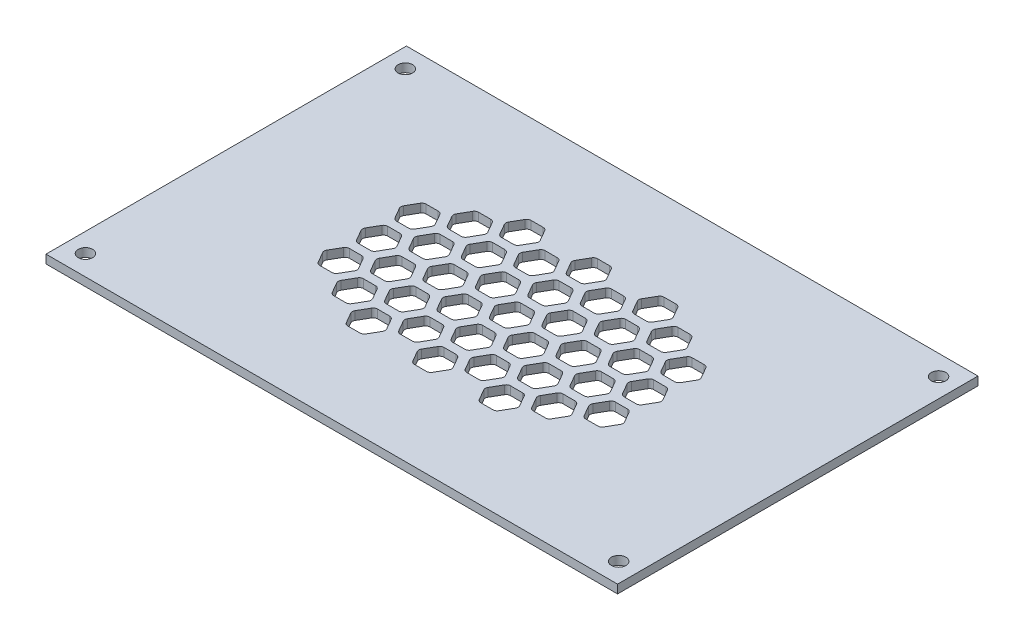
from build123d import *

# Parameters (mm, degrees)
SKETCH1_W                = 134
SKETCH1_H                = 84.5
BOSS_EXTRUDE1_DEPTH      = 2
M3_CLEARANCE_HOLE1_D     = 3.4
M3_CLEARANCE_HOLE1_DEPTH = 5
M3_CLEARANCE_HOLE1_TIP   = 1.021463052
FILL_PATTERN1_DEPTH      = 2
FILLET1_R                = 1


# Read off the part's stored shape, not the designer's step: Fill Pattern1
with BuildPart() as part:
    # Sketch1 → Boss-Extrude1 (new body)
    with BuildSketch(Plane(origin=(0, 0, 0), x_dir=(1, 0, 0), z_dir=(0, 1, 0))):
        with Locations((67, 42.25)):
            Rectangle(SKETCH1_W, SKETCH1_H)
    extrude(amount=BOSS_EXTRUDE1_DEPTH)

    # M3 Clearance Hole1
    with Locations(Plane(origin=(0, 2, 0), x_dir=(1, 0, 0), z_dir=(0, 1, 0))):
        with Locations((4.5, 79.75), (129.5, 79.75), (129.5, 4.75), (4.5, 4.75)):
            Hole(M3_CLEARANCE_HOLE1_D / 2, depth=M3_CLEARANCE_HOLE1_DEPTH)
            with Locations((0, 0, -(M3_CLEARANCE_HOLE1_DEPTH + M3_CLEARANCE_HOLE1_TIP / 2))):  # 118° drill point
                Cone(0, M3_CLEARANCE_HOLE1_D / 2, M3_CLEARANCE_HOLE1_TIP, mode=Mode.SUBTRACT)

    # Fill Pattern1 outline → Fill Pattern1 (cut)
    with BuildSketch(Plane(origin=(0, 0, 0), x_dir=(1, 0, 0), z_dir=(0, 1, 0))):
        Polygon((86.588457268, 24.25), (84.588457268, 27.714101615), (80.588457268, 27.714101615), (78.588457268, 24.25), (80.588457268, 20.785898385), (84.588457268, 20.785898385), align=None)
        Polygon((78.794228634, 37.75), (76.794228634, 41.214101615), (72.794228634, 41.214101615), (70.794228634, 37.75), (72.794228634, 34.285898385), (76.794228634, 34.285898385), align=None)
        Polygon((71, 51.25), (69, 54.714101615), (65, 54.714101615), (63, 51.25), (65, 47.785898385), (69, 47.785898385), align=None)
        Polygon((69, 27.714101615), (65, 27.714101615), (63, 24.25), (65, 20.785898385), (69, 20.785898385), (71, 24.25), align=None)
        Polygon((53.411542732, 27.714101615), (49.411542732, 27.714101615), (47.411542732, 24.25), (49.411542732, 20.785898385), (53.411542732, 20.785898385), (55.411542732, 24.25), align=None)
        Polygon((88.382685902, 41.214101615), (86.382685902, 37.75), (88.382685902, 34.285898385), (92.382685902, 34.285898385), (94.382685902, 37.75), (92.382685902, 41.214101615), align=None)
        Polygon((96.176914536, 54.714101615), (94.176914536, 51.25), (96.176914536, 47.785898385), (100.176914536, 47.785898385), (102.176914536, 51.25), (100.176914536, 54.714101615), align=None)
        Polygon((39.823085464, 33.25), (37.823085464, 36.714101615), (33.823085464, 36.714101615), (31.823085464, 33.25), (33.823085464, 29.785898385), (37.823085464, 29.785898385), align=None)
        Polygon((100.176914536, 36.714101615), (96.176914536, 36.714101615), (94.176914536, 33.25), (96.176914536, 29.785898385), (100.176914536, 29.785898385), (102.176914536, 33.25), align=None)
        Polygon((53.411542732, 36.714101615), (49.411542732, 36.714101615), (47.411542732, 33.25), (49.411542732, 29.785898385), (53.411542732, 29.785898385), (55.411542732, 33.25), align=None)
        Polygon((84.588457268, 36.714101615), (80.588457268, 36.714101615), (78.588457268, 33.25), (80.588457268, 29.785898385), (84.588457268, 29.785898385), (86.588457268, 33.25), align=None)
        Polygon((69, 36.714101615), (65, 36.714101615), (63, 33.25), (65, 29.785898385), (69, 29.785898385), (71, 33.25), align=None)
        Polygon((41.617314098, 50.214101615), (39.617314098, 46.75), (41.617314098, 43.285898385), (45.617314098, 43.285898385), (47.617314098, 46.75), (45.617314098, 50.214101615), align=None)
        Polygon((49.411542732, 63.714101615), (47.411542732, 60.25), (49.411542732, 56.785898385), (53.411542732, 56.785898385), (55.411542732, 60.25), (53.411542732, 63.714101615), align=None)
        Polygon((39.823085464, 42.25), (37.823085464, 45.714101615), (33.823085464, 45.714101615), (31.823085464, 42.25), (33.823085464, 38.785898385), (37.823085464, 38.785898385), align=None)
        Polygon((47.617314098, 28.75), (45.617314098, 32.214101615), (41.617314098, 32.214101615), (39.617314098, 28.75), (41.617314098, 25.285898385), (45.617314098, 25.285898385), align=None)
        Polygon((53.411542732, 45.714101615), (49.411542732, 45.714101615), (47.411542732, 42.25), (49.411542732, 38.785898385), (53.411542732, 38.785898385), (55.411542732, 42.25), align=None)
        Polygon((69, 45.714101615), (65, 45.714101615), (63, 42.25), (65, 38.785898385), (69, 38.785898385), (71, 42.25), align=None)
        Polygon((100.176914536, 45.714101615), (96.176914536, 45.714101615), (94.176914536, 42.25), (96.176914536, 38.785898385), (100.176914536, 38.785898385), (102.176914536, 42.25), align=None)
        Polygon((84.588457268, 45.714101615), (80.588457268, 45.714101615), (78.588457268, 42.25), (80.588457268, 38.785898385), (84.588457268, 38.785898385), (86.588457268, 42.25), align=None)
        Polygon((41.617314098, 59.214101615), (39.617314098, 55.75), (41.617314098, 52.285898385), (45.617314098, 52.285898385), (47.617314098, 55.75), (45.617314098, 59.214101615), align=None)
        Polygon((39.823085464, 51.25), (37.823085464, 54.714101615), (33.823085464, 54.714101615), (31.823085464, 51.25), (33.823085464, 47.785898385), (37.823085464, 47.785898385), align=None)
        Polygon((47.617314098, 37.75), (45.617314098, 41.214101615), (41.617314098, 41.214101615), (39.617314098, 37.75), (41.617314098, 34.285898385), (45.617314098, 34.285898385), align=None)
        Polygon((53.411542732, 54.714101615), (49.411542732, 54.714101615), (47.411542732, 51.25), (49.411542732, 47.785898385), (53.411542732, 47.785898385), (55.411542732, 51.25), align=None)
        Polygon((84.588457268, 54.714101615), (80.588457268, 54.714101615), (78.588457268, 51.25), (80.588457268, 47.785898385), (84.588457268, 47.785898385), (86.588457268, 51.25), align=None)
        Polygon((94.382685902, 28.75), (92.382685902, 32.214101615), (88.382685902, 32.214101615), (86.382685902, 28.75), (88.382685902, 25.285898385), (92.382685902, 25.285898385), align=None)
        Polygon((78.794228634, 55.75), (76.794228634, 59.214101615), (72.794228634, 59.214101615), (70.794228634, 55.75), (72.794228634, 52.285898385), (76.794228634, 52.285898385), align=None)
        Polygon((76.794228634, 32.214101615), (72.794228634, 32.214101615), (70.794228634, 28.75), (72.794228634, 25.285898385), (76.794228634, 25.285898385), (78.794228634, 28.75), align=None)
        Polygon((61.205771366, 32.214101615), (57.205771366, 32.214101615), (55.205771366, 28.75), (57.205771366, 25.285898385), (61.205771366, 25.285898385), (63.205771366, 28.75), align=None)
        Polygon((63.205771366, 37.75), (61.205771366, 41.214101615), (57.205771366, 41.214101615), (55.205771366, 37.75), (57.205771366, 34.285898385), (61.205771366, 34.285898385), align=None)
        Polygon((57.205771366, 59.214101615), (55.205771366, 55.75), (57.205771366, 52.285898385), (61.205771366, 52.285898385), (63.205771366, 55.75), (61.205771366, 59.214101615), align=None)
        Polygon((61.205771366, 50.214101615), (57.205771366, 50.214101615), (55.205771366, 46.75), (57.205771366, 43.285898385), (61.205771366, 43.285898385), (63.205771366, 46.75), align=None)
        Polygon((76.794228634, 50.214101615), (72.794228634, 50.214101615), (70.794228634, 46.75), (72.794228634, 43.285898385), (76.794228634, 43.285898385), (78.794228634, 46.75), align=None)
        Polygon((92.382685902, 50.214101615), (88.382685902, 50.214101615), (86.382685902, 46.75), (88.382685902, 43.285898385), (92.382685902, 43.285898385), (94.382685902, 46.75), align=None)
        Polygon((92.382685902, 59.214101615), (88.382685902, 59.214101615), (86.382685902, 55.75), (88.382685902, 52.285898385), (92.382685902, 52.285898385), (94.382685902, 55.75), align=None)
        Polygon((86.588457268, 60.25), (84.588457268, 63.714101615), (80.588457268, 63.714101615), (78.588457268, 60.25), (80.588457268, 56.785898385), (84.588457268, 56.785898385), align=None)
        Polygon((65, 63.714101615), (63, 60.25), (65, 56.785898385), (69, 56.785898385), (71, 60.25), (69, 63.714101615), align=None)
    extrude(amount=FILL_PATTERN1_DEPTH, mode=Mode.SUBTRACT)

    # Fillet1
    fillet1_edges = [part.edges().sort_by_distance(p)[0] for p in [
        (92.382685902, 1, -32.214101615),
        (88.382685902, 1, -32.214101615),
        (86.382685902, 1, -28.75),
        (88.382685902, 1, -25.285898385),
        (92.382685902, 1, -25.285898385),
        (94.382685902, 1, -28.75),
        (69, 1, -27.714101615),
        (65, 1, -27.714101615),
        (63, 1, -24.25),
        (65, 1, -20.785898385),
        (69, 1, -20.785898385),
        (71, 1, -24.25),
        (53.411542732, 1, -27.714101615),
        (49.411542732, 1, -27.714101615),
        (47.411542732, 1, -24.25),
        (49.411542732, 1, -20.785898385),
        (53.411542732, 1, -20.785898385),
        (55.411542732, 1, -24.25),
        (45.617314098, 1, -32.214101615),
        (41.617314098, 1, -32.214101615),
        (39.617314098, 1, -28.75),
        (41.617314098, 1, -25.285898385),
        (45.617314098, 1, -25.285898385),
        (47.617314098, 1, -28.75),
        (45.617314098, 1, -41.214101615),
        (41.617314098, 1, -41.214101615),
        (39.617314098, 1, -37.75),
        (41.617314098, 1, -34.285898385),
        (45.617314098, 1, -34.285898385),
        (47.617314098, 1, -37.75),
        (45.617314098, 1, -50.214101615),
        (41.617314098, 1, -50.214101615),
        (39.617314098, 1, -46.75),
        (41.617314098, 1, -43.285898385),
        (45.617314098, 1, -43.285898385),
        (47.617314098, 1, -46.75),
        (45.617314098, 1, -59.214101615),
        (41.617314098, 1, -59.214101615),
        (39.617314098, 1, -55.75),
        (41.617314098, 1, -52.285898385),
        (45.617314098, 1, -52.285898385),
        (47.617314098, 1, -55.75),
        (100.176914536, 1, -36.714101615),
        (96.176914536, 1, -36.714101615),
        (94.176914536, 1, -33.25),
        (96.176914536, 1, -29.785898385),
        (100.176914536, 1, -29.785898385),
        (102.176914536, 1, -33.25),
        (76.794228634, 1, -32.214101615),
        (72.794228634, 1, -32.214101615),
        (70.794228634, 1, -28.75),
        (72.794228634, 1, -25.285898385),
        (76.794228634, 1, -25.285898385),
        (78.794228634, 1, -28.75),
        (61.205771366, 1, -32.214101615),
        (57.205771366, 1, -32.214101615),
        (55.205771366, 1, -28.75),
        (57.205771366, 1, -25.285898385),
        (61.205771366, 1, -25.285898385),
        (63.205771366, 1, -28.75),
        (53.411542732, 1, -36.714101615),
        (49.411542732, 1, -36.714101615),
        (47.411542732, 1, -33.25),
        (49.411542732, 1, -29.785898385),
        (53.411542732, 1, -29.785898385),
        (55.411542732, 1, -33.25),
        (53.411542732, 1, -45.714101615),
        (49.411542732, 1, -45.714101615),
        (47.411542732, 1, -42.25),
        (49.411542732, 1, -38.785898385),
        (53.411542732, 1, -38.785898385),
        (55.411542732, 1, -42.25),
        (53.411542732, 1, -54.714101615),
        (49.411542732, 1, -54.714101615),
        (47.411542732, 1, -51.25),
        (49.411542732, 1, -47.785898385),
        (53.411542732, 1, -47.785898385),
        (55.411542732, 1, -51.25),
        (53.411542732, 1, -63.714101615),
        (49.411542732, 1, -63.714101615),
        (47.411542732, 1, -60.25),
        (49.411542732, 1, -56.785898385),
        (53.411542732, 1, -56.785898385),
        (55.411542732, 1, -60.25),
        (84.588457268, 1, -36.714101615),
        (80.588457268, 1, -36.714101615),
        (78.588457268, 1, -33.25),
        (80.588457268, 1, -29.785898385),
        (84.588457268, 1, -29.785898385),
        (86.588457268, 1, -33.25),
        (69, 1, -36.714101615),
        (65, 1, -36.714101615),
        (63, 1, -33.25),
        (65, 1, -29.785898385),
        (69, 1, -29.785898385),
        (71, 1, -33.25),
        (61.205771366, 1, -41.214101615),
        (57.205771366, 1, -41.214101615),
        (55.205771366, 1, -37.75),
        (57.205771366, 1, -34.285898385),
        (61.205771366, 1, -34.285898385),
        (63.205771366, 1, -37.75),
        (61.205771366, 1, -50.214101615),
        (57.205771366, 1, -50.214101615),
        (55.205771366, 1, -46.75),
        (57.205771366, 1, -43.285898385),
        (61.205771366, 1, -43.285898385),
        (63.205771366, 1, -46.75),
        (61.205771366, 1, -59.214101615),
        (57.205771366, 1, -59.214101615),
        (55.205771366, 1, -55.75),
        (57.205771366, 1, -52.285898385),
        (61.205771366, 1, -52.285898385),
        (63.205771366, 1, -55.75),
        (92.382685902, 1, -41.214101615),
        (88.382685902, 1, -41.214101615),
        (86.382685902, 1, -37.75),
        (88.382685902, 1, -34.285898385),
        (92.382685902, 1, -34.285898385),
        (94.382685902, 1, -37.75),
        (76.794228634, 1, -41.214101615),
        (72.794228634, 1, -41.214101615),
        (70.794228634, 1, -37.75),
        (72.794228634, 1, -34.285898385),
        (76.794228634, 1, -34.285898385),
        (78.794228634, 1, -37.75),
        (84.588457268, 1, -27.714101615),
        (80.588457268, 1, -27.714101615),
        (78.588457268, 1, -24.25),
        (69, 1, -45.714101615),
        (65, 1, -45.714101615),
        (63, 1, -42.25),
        (80.588457268, 1, -20.785898385),
        (65, 1, -38.785898385),
        (69, 1, -38.785898385),
        (71, 1, -42.25),
        (84.588457268, 1, -20.785898385),
        (86.588457268, 1, -24.25),
        (69, 1, -54.714101615),
        (65, 1, -54.714101615),
        (63, 1, -51.25),
        (65, 1, -47.785898385),
        (69, 1, -47.785898385),
        (71, 1, -51.25),
        (69, 1, -63.714101615),
        (65, 1, -63.714101615),
        (63, 1, -60.25),
        (65, 1, -56.785898385),
        (69, 1, -56.785898385),
        (71, 1, -60.25),
        (100.176914536, 1, -45.714101615),
        (96.176914536, 1, -45.714101615),
        (94.176914536, 1, -42.25),
        (96.176914536, 1, -38.785898385),
        (100.176914536, 1, -38.785898385),
        (102.176914536, 1, -42.25),
        (84.588457268, 1, -45.714101615),
        (80.588457268, 1, -45.714101615),
        (78.588457268, 1, -42.25),
        (80.588457268, 1, -38.785898385),
        (84.588457268, 1, -38.785898385),
        (86.588457268, 1, -42.25),
        (76.794228634, 1, -50.214101615),
        (72.794228634, 1, -50.214101615),
        (70.794228634, 1, -46.75),
        (72.794228634, 1, -43.285898385),
        (76.794228634, 1, -43.285898385),
        (78.794228634, 1, -46.75),
        (76.794228634, 1, -59.214101615),
        (72.794228634, 1, -59.214101615),
        (70.794228634, 1, -55.75),
        (72.794228634, 1, -52.285898385),
        (76.794228634, 1, -52.285898385),
        (78.794228634, 1, -55.75),
        (92.382685902, 1, -50.214101615),
        (88.382685902, 1, -50.214101615),
        (86.382685902, 1, -46.75),
        (88.382685902, 1, -43.285898385),
        (92.382685902, 1, -43.285898385),
        (94.382685902, 1, -46.75),
        (84.588457268, 1, -54.714101615),
        (80.588457268, 1, -54.714101615),
        (78.588457268, 1, -51.25),
        (80.588457268, 1, -47.785898385),
        (84.588457268, 1, -47.785898385),
        (86.588457268, 1, -51.25),
        (84.588457268, 1, -63.714101615),
        (80.588457268, 1, -63.714101615),
        (78.588457268, 1, -60.25),
        (80.588457268, 1, -56.785898385),
        (84.588457268, 1, -56.785898385),
        (86.588457268, 1, -60.25),
        (37.823085464, 1, -36.714101615),
        (33.823085464, 1, -36.714101615),
        (31.823085464, 1, -33.25),
        (100.176914536, 1, -54.714101615),
        (96.176914536, 1, -54.714101615),
        (94.176914536, 1, -51.25),
        (33.823085464, 1, -29.785898385),
        (96.176914536, 1, -47.785898385),
        (100.176914536, 1, -47.785898385),
        (102.176914536, 1, -51.25),
        (37.823085464, 1, -29.785898385),
        (39.823085464, 1, -33.25),
        (92.382685902, 1, -59.214101615),
        (88.382685902, 1, -59.214101615),
        (86.382685902, 1, -55.75),
        (88.382685902, 1, -52.285898385),
        (92.382685902, 1, -52.285898385),
        (94.382685902, 1, -55.75),
        (37.823085464, 1, -45.714101615),
        (33.823085464, 1, -45.714101615),
        (31.823085464, 1, -42.25),
        (33.823085464, 1, -38.785898385),
        (37.823085464, 1, -38.785898385),
        (39.823085464, 1, -42.25),
        (37.823085464, 1, -54.714101615),
        (33.823085464, 1, -54.714101615),
        (31.823085464, 1, -51.25),
        (33.823085464, 1, -47.785898385),
        (37.823085464, 1, -47.785898385),
        (39.823085464, 1, -51.25),
    ]]
    fillet(fillet1_edges, radius=FILLET1_R)


solid = part.part
